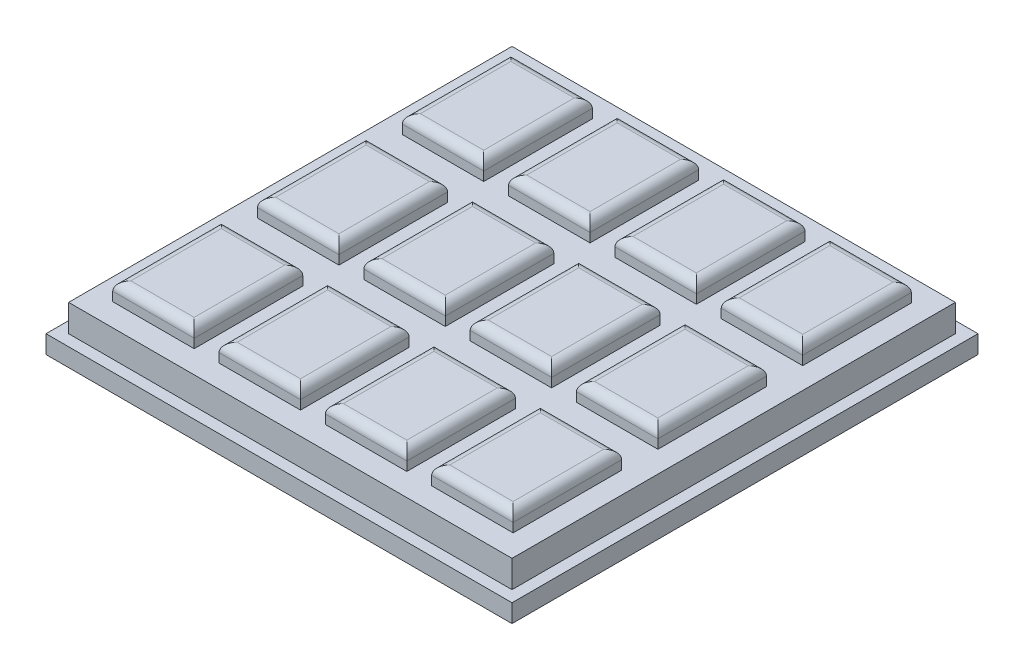
from build123d import *

# Parameters (mm, degrees)
SKETCH1_W              = 49
SKETCH1_H              = 49
BOSS_EXTRUDE1_DEPTH    = 3
SKETCH2_W              = 9
SKETCH2_H              = 12
BOSS_EXTRUDE2_DEPTH    = 2
FILLET1_R              = 1
LPATTERN1_COUNT        = 4
LPATTERN1_PITCH        = 11.75
LPATTERN1_COUNT_DIR2   = 3
LPATTERN1_PITCH_DIR2   = 16
FILLET1_OF_LPATTERN1_R = 1
SKETCH3_W              = 51.5
SKETCH3_H              = 51.5
BOSS_EXTRUDE3_DEPTH    = 2


with BuildPart() as part:
    # Sketch1 → Boss-Extrude1 (new body)
    with BuildSketch(Plane(origin=(0, 0, 0), x_dir=(1, 0, 0), z_dir=(0, 1, 0))):
        Rectangle(SKETCH1_W, SKETCH1_H)
    extrude(amount=BOSS_EXTRUDE1_DEPTH)

    # Sketch2 → Boss-Extrude2 (add)
    with BuildSketch(Plane(origin=(0, 3, 0), x_dir=(1, 0, 0), z_dir=(0, 1, 0))):
        with Locations((-17.625, 16)):
            Rectangle(SKETCH2_W, SKETCH2_H)
    boss_extrude2 = extrude(amount=BOSS_EXTRUDE2_DEPTH)

    # Fillet1
    fillet1_edges = [part.edges().sort_by_distance(p)[0] for p in [
        (-13.125, 5, -16),
        (-17.625, 5, -22),
        (-22.125, 5, -16),
        (-17.625, 5, -10),
    ]]
    fillet(fillet1_edges, radius=FILLET1_R)

    # LPattern1: Boss-Extrude2 4 × 3
    with Locations(*[(i * LPATTERN1_PITCH, 0, j * LPATTERN1_PITCH_DIR2) for i in range(LPATTERN1_COUNT) for j in range(LPATTERN1_COUNT_DIR2) if (i, j) != (0, 0)]):
        add(boss_extrude2)

    # Fillet1 of LPattern1
    fillet1_of_lpattern1_edges = [part.edges().sort_by_distance(p)[0] for p in [
        (-13.125, 5, 0),
        (-17.625, 5, -6),
        (-22.125, 5, 0),
        (-17.625, 5, 6),
        (-13.125, 5, 16),
        (-17.625, 5, 10),
        (-22.125, 5, 16),
        (-17.625, 5, 22),
        (-1.375, 5, -16),
        (-5.875, 5, -22),
        (-10.375, 5, -16),
        (-5.875, 5, -10),
        (-1.375, 5, 0),
        (-5.875, 5, -6),
        (-10.375, 5, 0),
        (-5.875, 5, 6),
        (-1.375, 5, 16),
        (-5.875, 5, 10),
        (-10.375, 5, 16),
        (-5.875, 5, 22),
        (10.375, 5, -16),
        (5.875, 5, -22),
        (1.375, 5, -16),
        (5.875, 5, -10),
        (10.375, 5, 0),
        (5.875, 5, -6),
        (1.375, 5, 0),
        (5.875, 5, 6),
        (10.375, 5, 16),
        (5.875, 5, 10),
        (1.375, 5, 16),
        (5.875, 5, 22),
        (22.125, 5, -16),
        (17.625, 5, -22),
        (13.125, 5, -16),
        (17.625, 5, -10),
        (22.125, 5, 0),
        (17.625, 5, -6),
        (13.125, 5, 0),
        (17.625, 5, 6),
        (22.125, 5, 16),
        (17.625, 5, 10),
        (13.125, 5, 16),
        (17.625, 5, 22),
    ]]
    fillet(fillet1_of_lpattern1_edges, radius=FILLET1_OF_LPATTERN1_R)

    # Sketch3 → Boss-Extrude3 (add)
    with BuildSketch(Plane.XZ):
        Rectangle(SKETCH3_W, SKETCH3_H)
    extrude(amount=BOSS_EXTRUDE3_DEPTH)


solid = part.part
